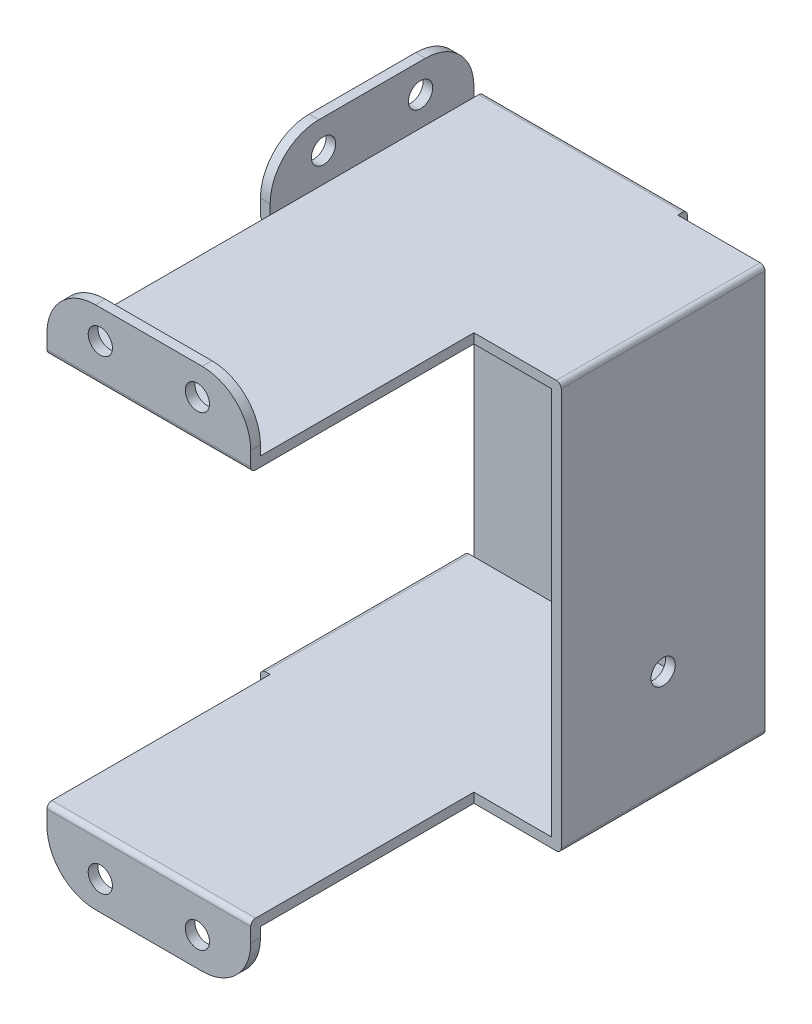
from build123d import *

# Parameters (mm, degrees)
SKETCH_1_W         = 31
SKETCH_1_H         = 21
EXTRUDE_1_DEPTH    = 42
SHELL_1_T          = -1
SKETCH_2_W         = 5
SKETCH_2_H         = 21
EXTRUDE_2_DEPTH    = 6
SHELL_START        = 42
SHELL_2_OUTLINE_W  = 4
SHELL_2_OUTLINE_H  = 21
SHELL_2_DEPTH      = 6
SKETCH_3_W         = 5
SKETCH_3_H         = 21
EXTRUDE_3_DEPTH    = 6
SHELL_START_2      = -6
SHELL_3_OUTLINE_W  = 4
SHELL_3_OUTLINE_H  = 21
SHELL_3_DEPTH      = 6
SKETCH_4_W         = 21
SKETCH_4_H         = 1
EXTRUDE_4_DEPTH    = 23
SKETCH_5_W         = 21
SKETCH_5_H         = 5
EXTRUDE_5_DEPTH    = 6
SHELL_START_3      = 18
SHELL_4_OUTLINE_W  = 21
SHELL_4_OUTLINE_H  = 6
SHELL_4_DEPTH      = 4
SKETCH_6_W         = 21
SKETCH_6_H         = 5
EXTRUDE_6_DEPTH    = 6
SHELL_5_OUTLINE_W  = 21
SHELL_5_OUTLINE_H  = 6
SHELL_5_DEPTH      = 4
SKETCH_8_W         = 21
SKETCH_8_H         = 42
EXTRUDE_7_DEPTH    = 1
HOLE_WIZARD_M3_1_D = 2.5
HOLE_WIZARD_M3_2_D = 2.5
HOLE_WIZARD_M3_3_D = 2.5
HOLE_WIZARD_M3_4_D = 2.5
FILLET_2_R         = 0.5
FILLET_3_R         = 5


# Read off the part's stored shape, not the designer's step: 抽壳2, 抽壳3, 抽壳4, 抽壳5
with BuildPart() as part:
    # 草图1 → 凸台-拉伸1 (new body)
    with BuildSketch(Plane(origin=(0, 0, 0), x_dir=(1, 0, 0), z_dir=(0, 1, 0))):
        with Locations((-15.5, 10.5)):
            Rectangle(SKETCH_1_W, SKETCH_1_H)
    extrude(amount=EXTRUDE_1_DEPTH)

    # 抽壳1
    shell_1_openings = [part.faces().sort_by_distance(p)[0] for p in [
        (-15.5, 21, 0),
        (-31, 21, -10.5),
        (-15.5, 21, -21),
    ]]
    offset(amount=SHELL_1_T, openings=shell_1_openings, kind=Kind.INTERSECTION)

    # 草图2 → 凸台-拉伸2 (add)
    with BuildSketch(Plane(origin=(0, 42, 0), x_dir=(1, 0, 0), z_dir=(0, 1, 0))):
        with Locations((-28.5, 10.5)):
            Rectangle(SKETCH_2_W, SKETCH_2_H)
    extrude(amount=EXTRUDE_2_DEPTH)

    # 抽壳2 outline → 抽壳2 (cut)
    with BuildSketch(Plane(origin=(0, 0, 0), x_dir=(1, 0, 0), z_dir=(0, 1, 0)).offset(SHELL_START)):
        with Locations((-28, 10.5)):
            Rectangle(SHELL_2_OUTLINE_W, SHELL_2_OUTLINE_H)
    extrude(amount=SHELL_2_DEPTH, mode=Mode.SUBTRACT)

    # 草图3 → 凸台-拉伸3 (add)
    with BuildSketch(Plane.XZ):
        with Locations((-28.5, -10.5)):
            Rectangle(SKETCH_3_W, SKETCH_3_H)
    extrude(amount=EXTRUDE_3_DEPTH)

    # 抽壳3 outline → 抽壳3 (cut)
    with BuildSketch(Plane(origin=(0, 0, 0), x_dir=(1, 0, 0), z_dir=(0, 1, 0)).offset(SHELL_START_2)):
        with Locations((-28, 10.5)):
            Rectangle(SHELL_3_OUTLINE_W, SHELL_3_OUTLINE_H)
    extrude(amount=SHELL_3_DEPTH, mode=Mode.SUBTRACT)

    # 草图4 → 凸台-拉伸4 (add)
    with BuildSketch(Plane.XY):
        with Locations((-19.5, 41.5)):
            Rectangle(SKETCH_4_W, SKETCH_4_H)
        with Locations((-19.5, 0.5)):
            Rectangle(SKETCH_4_W, SKETCH_4_H)
    extrude(amount=EXTRUDE_4_DEPTH)

    # 草图5 → 凸台-拉伸5 (add)
    with BuildSketch(Plane(origin=(0, 42, 0), x_dir=(1, 0, 0), z_dir=(0, 1, 0))):
        with Locations((-19.5, -20.5)):
            Rectangle(SKETCH_5_W, SKETCH_5_H)
    extrude(amount=EXTRUDE_5_DEPTH)

    # 抽壳4 outline → 抽壳4 (cut)
    with BuildSketch(Plane.XY.offset(SHELL_START_3)):
        with Locations((-19.5, 45)):
            Rectangle(SHELL_4_OUTLINE_W, SHELL_4_OUTLINE_H)
    extrude(amount=SHELL_4_DEPTH, mode=Mode.SUBTRACT)

    # 草图6 → 凸台-拉伸6 (add)
    with BuildSketch(Plane.XZ):
        with Locations((-19.5, 20.5)):
            Rectangle(SKETCH_6_W, SKETCH_6_H)
    extrude(amount=EXTRUDE_6_DEPTH)

    # 抽壳5 outline → 抽壳5 (cut)
    with BuildSketch(Plane.XY.offset(SHELL_START_3)):
        with Locations((-19.5, -3)):
            Rectangle(SHELL_5_OUTLINE_W, SHELL_5_OUTLINE_H)
    extrude(amount=SHELL_5_DEPTH, mode=Mode.SUBTRACT)

    # 草图8 → 凸台-拉伸7 (add)
    with BuildSketch(Plane(origin=(0, 0, -21), x_dir=(-1, 0, 0), z_dir=(0, 0, -1))):
        with Locations((19.5, 21)):
            Rectangle(SKETCH_8_W, SKETCH_8_H)
    extrude(amount=EXTRUDE_7_DEPTH)

    # M3 螺纹孔1 (through all)
    with Locations(Plane.XY.offset(23)):
        with Locations((-24.5, 45), (-14.5, 45), (-24.5, -3), (-14.5, -3)):
            Hole(HOLE_WIZARD_M3_1_D / 2)

    # M3 螺纹孔2 (through all)
    with Locations(Plane.ZY.offset(31)):
        with Locations((-5.5, 45), (-15.5, 45), (-15.5, -3), (-5.5, -3)):
            Hole(HOLE_WIZARD_M3_2_D / 2)

    # M3 螺纹孔3 (through all)
    with Locations(Plane(origin=(0, 0, 0), x_dir=(0, 0, -1), z_dir=(1, 0, 0))):
        with Locations((10.5, 11)):
            Hole(HOLE_WIZARD_M3_3_D / 2)

    # M3 螺纹孔4 (through all)
    with Locations(Plane(origin=(0, 0, -22), x_dir=(-1, 0, 0), z_dir=(0, 0, -1))):
        with Locations((19.5, 11)):
            Hole(HOLE_WIZARD_M3_4_D / 2)

    # 圆角2
    fillet_2_edges = [part.edges().sort_by_distance(p)[0] for p in [
        (-19.5, 42, -22),
        (-19.5, 0, -22),
        (-31, 1, -10.5),
        (-31, 41, -10.5),
        (0, 42, -10.5),
        (0, 0, -10.5),
        (-19.5, 41, 23),
        (-19.5, 1, 23),
    ]]
    fillet(fillet_2_edges, radius=FILLET_2_R)

    # 圆角3
    fillet_3_edges = [part.edges().sort_by_distance(p)[0] for p in [
        (-30, 48, 22.5),
        (-9, 48, 22.5),
        (-30, -6, 22.5),
        (-9, -6, 22.5),
        (-30.5, 48, -21),
        (-30.5, 48, 0),
        (-30.5, -6, -21),
        (-30.5, -6, 0),
    ]]
    fillet(fillet_3_edges, radius=FILLET_3_R)


solid = part.part
